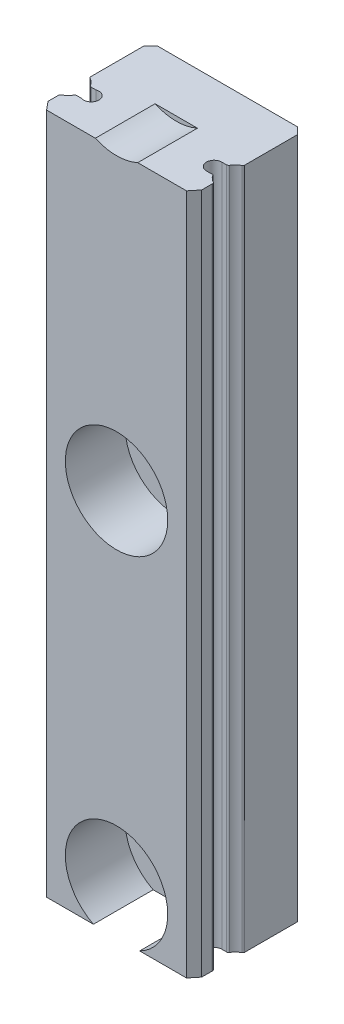
from build123d import *

# Parameters (mm, degrees)
RESSALTO_EXTRUS_O1_DEPTH                             = 1000
CORTE_EXTRUS_O1_START                                = -1000
CORTE_EXTRUS_O1_DEPTH                                = 1000
CORTE_EXTRUS_O2_DEPTH                                = 1001.031261626
CORTE_EXTRUS_O3_DEPTH                                = 1001.031261626
CORTE_EXTRUS_O4_DEPTH                                = 1001.031261626
CORTE_EXTRUS_O5_DEPTH                                = 0.002166667
CORTE_EXTRUS_O6_DEPTH                                = 0.002166667
CORTE_EXTRUS_O7_DEPTH                                = 0.002166667
CORTE_EXTRUS_O8_DEPTH                                = 0.002166667
INCLINA_O1_ANGLE                                     = 45.1469538
ESBO_O10_W                                           = 0.450000001
ESBO_O10_H                                           = 1000
REBAIXO_PARA_PARAFUSO_DE_M_QUINA_DE_CABE_D           = 3.5
REBAIXO_PARA_PARAFUSO_DE_M_QUINA_DE_CABE_CBORE_D     = 6
REBAIXO_PARA_PARAFUSO_DE_M_QUINA_DE_CABE_CBORE_DEPTH = 3.50000002
CHANFRO1_SIZE                                        = 0.062563219
CHANFRO1_SIZE2                                       = 0.062205617
CHANFRO3_START                                       = -3.730761794
CHANFRO3_DEPTH                                       = 0.399013115
CHANFRO4_SIZE                                        = 0.4
FILETE1_R                                            = 0.130000023
SKETCH1_W                                            = 36.072768502
SKETCH1_H                                            = 771.589023544
SKETCH1_W_2                                          = 21.632087489
SKETCH1_H_2                                          = 231.614654652
CUT_EXTRUDE1_DEPTH                                   = 10


with BuildPart() as part:
    # Esboço1 → Ressalto-extrusão1 (new body)
    with BuildSketch(Plane.XZ):
        with BuildLine():
            Line((4.5, 5.4097155), (4.5, 6.01167813))
            Line((4.5, 6.01167813), (4.1, 6.50000002))
            Line((4.1, 6.50000002), (-4.1, 6.50000002))
            Line((-4.1, 6.50000002), (-4.5, 6.01167813))
            Line((-4.5, 6.01167813), (-4.5, 2e-08))
            Line((-4.5, 2e-08), (4.5, 2e-08))
            Line((4.5, 2e-08), (4.5, 3.50196265))
            ThreePointArc((4.5, 3.50196265), (4.477413879, 3.553810372), (4.43494978, 3.59116167))
            ThreePointArc((4.43494978, 3.59116167), (3.930462682, 4.43021964), (4.43494978, 5.26927761))
            ThreePointArc((4.43494978, 5.26927761), (4.490651601, 5.328761203), (4.5, 5.4097155))
        make_face()
    extrude(amount=-RESSALTO_EXTRUS_O1_DEPTH)

    # Esboço2 → Corte-extrusão1 (cut)
    with BuildSketch(Plane(origin=(0, 1000, 0), x_dir=(-1, 0, 0), z_dir=(0, 1, 0)).offset(CORTE_EXTRUS_O1_START)):
        with BuildLine():
            Line((-4.030498711, 4.00588336), (-3.673447948, 4.00588336))
            ThreePointArc((-3.673447948, 4.00588336), (-3.223447946, 4.455883362), (-3.673447948, 4.905883363))
            Line((-3.673447948, 4.905883363), (-3.953580008, 4.905883363))
            ThreePointArc((-3.953580008, 4.905883363), (-4.010719931, 4.899199784), (-4.065149208, 4.917830263))
            ThreePointArc((-4.065149208, 4.917830263), (-3.93114763, 4.466290066), (-4.030498711, 4.00588336))
        make_face()
    extrude(amount=CORTE_EXTRUS_O1_DEPTH, mode=Mode.SUBTRACT)

    # Esboço3 → Corte-extrusão2 (cut, through all)
    with BuildSketch(Plane(origin=(0, 1000, 0), x_dir=(-1, 0, 0), z_dir=(0, 1, 0))):
        with BuildLine():
            Line((4.5, 4.03150278), (4.5, 4.88017535))
            Line((4.5, 4.88017535), (3.66946318, 4.88017535))
            ThreePointArc((3.66946318, 4.88017535), (3.969667593, 4.455839065), (3.66946318, 4.03150278))
            Line((3.66946318, 4.03150278), (4.5, 4.03150278))
        make_face()
    extrude(amount=-CORTE_EXTRUS_O2_DEPTH, mode=Mode.SUBTRACT)

    # Esboço4 → Corte-extrusão3 (cut, through all)
    with BuildSketch(Plane(origin=(0, 1000, 0), x_dir=(-1, 0, 0), z_dir=(0, 1, 0))):
        with BuildLine():
            Line((4.026513974, 4.88017535), (4.5, 4.88017535))
            Line((4.5, 4.88017535), (4.5, 5.328056964))
            ThreePointArc((4.5, 5.328056964), (4.223646078, 5.145991535), (4.026513974, 4.88017535))
        make_face()
    extrude(amount=-CORTE_EXTRUS_O3_DEPTH, mode=Mode.SUBTRACT)

    # Esboço5 → Corte-extrusão4 (cut, through all)
    with BuildSketch(Plane(origin=(0, 1000, 0), x_dir=(-1, 0, 0), z_dir=(0, 1, 0))):
        with BuildLine():
            Line((4.5, 3.583620931), (4.5, 4.03150278))
            Line((4.5, 4.03150278), (4.026513856, 4.03150278))
            ThreePointArc((4.026513856, 4.03150278), (4.223645982, 3.76568645), (4.5, 3.583620931))
        make_face()
    extrude(amount=-CORTE_EXTRUS_O4_DEPTH, mode=Mode.SUBTRACT)

    # Esboço6 → Corte-extrusão5 (cut)
    with BuildSketch(Plane(origin=(0, 1000, 0), x_dir=(-1, 0, 0), z_dir=(0, 1, 0))):
        Polygon((0.891369267, 3.403698133), (0.714701433, 3.168235633), (0.2187042, 2.61105), (1.0945792, 2.61105), (1.0945792, 2.695983333), (0.398689633, 2.695983333), (0.794326433, 3.149466667), (0.9743123, 3.3891), (1.067110588, 3.573407857), (0.95413722, 3.802321701), (0.7876908, 3.88505), (0.54301, 3.88505), (0.375434678, 3.803592619), (0.295011167, 3.6384023), (0.295011167, 3.562), (0.3812718, 3.562), (0.3812718, 3.631766667), (0.437672733, 3.743620833), (0.549645633, 3.800116667), (0.7802262, 3.800116667), (0.893028067, 3.743810633), (0.976240026, 3.576039029), align=None)
    extrude(amount=-CORTE_EXTRUS_O5_DEPTH, mode=Mode.SUBTRACT)

    # Esboço7 → Corte-extrusão6 (cut)
    with BuildSketch(Plane.XZ):
        Polygon((-0.214632167, 3.88505), (-0.953983333, 3.88505), (-0.953983333, 2.61105), (-0.214632167, 2.61105), (-0.214632167, 2.695983333), (-0.86905, 2.695983333), (-0.86905, 3.205583333), (-0.5123963, 3.205583333), (-0.5123963, 3.290516667), (-0.86905, 3.290516667), (-0.86905, 3.800116667), (-0.214632167, 3.800116667), align=None)
    extrude(amount=-CORTE_EXTRUS_O6_DEPTH, mode=Mode.SUBTRACT)

    # Esboço8 → Corte-extrusão7 (cut)
    with BuildSketch(Plane(origin=(0, 1000, 0), x_dir=(-1, 0, 0), z_dir=(0, 1, 0))):
        Polygon((-0.214632167, 3.88505), (-0.953983333, 3.88505), (-0.953983333, 2.61105), (-0.214632167, 2.61105), (-0.214632167, 2.695983333), (-0.86905, 2.695983333), (-0.86905, 3.205583333), (-0.5123963, 3.205583333), (-0.5123963, 3.290516667), (-0.86905, 3.290516667), (-0.86905, 3.800116667), (-0.214632167, 3.800116667), align=None)
    extrude(amount=-CORTE_EXTRUS_O7_DEPTH, mode=Mode.SUBTRACT)

    # Esboço9 → Corte-extrusão8 (cut)
    with BuildSketch(Plane.XZ):
        Polygon((0.510057167, 3.620830633), (0.6071, 3.718655633), (0.6071, 2.609403333), (0.692033333, 2.609403333), (0.692033333, 3.883403333), (0.6741176, 3.883403333), (0.6741176, 3.795069794), (0.3690544, 3.640736667), (0.3690544, 3.551253333), align=None)
    extrude(amount=-CORTE_EXTRUS_O8_DEPTH, mode=Mode.SUBTRACT)

    # Inclinação1
    inclina_o1_faces = [part.faces().sort_by_distance(p)[0] for p in [
        (0.6741176, 0.001083333, 3.839236564),
    ]]
    draft(inclina_o1_faces, Plane(origin=(0.692033333, 0.002166667, 3.883403333), x_dir=(-1, 0, 0), z_dir=(0, 0, -1)), INCLINA_O1_ANGLE)

    # Esboço10 → Corte-Revolução1 (revolve, cut)
    with BuildSketch(Plane.XY.offset(4.455839065)):
        with Locations((-3.294667591, 500)):
            Rectangle(ESBO_O10_W, ESBO_O10_H)
    revolve(axis=Axis((-3.519667591, 1000, 4.455839065), (0, -1, 0)), mode=Mode.SUBTRACT)

    # Rebaixo para parafuso de máquina de cabeça sextavada de M31 (through all)
    with Locations(Plane.XY.offset(6.50000002)):
        with Locations((0, 221.298822188), (0, 201.298822188), (0, 241.298822188), (0, 261.298822188)):
            CounterBoreHole(REBAIXO_PARA_PARAFUSO_DE_M_QUINA_DE_CABE_D / 2, REBAIXO_PARA_PARAFUSO_DE_M_QUINA_DE_CABE_CBORE_D / 2, REBAIXO_PARA_PARAFUSO_DE_M_QUINA_DE_CABE_CBORE_DEPTH)

    # Chanfro1
    chanfro1_edges = [part.edges().sort_by_distance(p)[0] for p in [
        (-0.976240026, 999.998916667, 3.576039029),
    ]]
    chanfro1_side = [part.faces().sort_by_distance(p)[0] for p in [
        (-0.933804646, 999.998916667, 3.489868581),
    ]]
    chamfer(chanfro1_edges, length=CHANFRO1_SIZE, length2=CHANFRO1_SIZE2, reference=chanfro1_side[0])

    # Chanfro3: read off the stored shape, not the designer's step
    # Chanfro3 outline → Chanfro3 (add)
    with BuildSketch(Plane(origin=(0, 0, 0), x_dir=(0.8991051825477068, 0, 0.43773264753254887), z_dir=(0.4377326475325489, 0, -0.8991051825477069)).offset(CHANFRO3_START)):
        Polygon((1.327401403, -999.997833333), (1.31122788, -999.997833333), (1.311999664, -1000), (1.327401403, -1000), align=None)
    extrude(amount=CHANFRO3_DEPTH)

    # Chanfro4
    chanfro4_edges = [part.edges().sort_by_distance(p)[0] for p in [
        (4.5, 500, 2e-08),
        (-4.5, 500, 2e-08),
    ]]
    chamfer(chanfro4_edges, length=CHANFRO4_SIZE)

    # Filete1
    filete1_edges = [part.edges().sort_by_distance(p)[0] for p in [
        (4.030498711, 500, 4.00588336),
        (-4.026513974, 500, 4.88017535),
        (-4.5, 500, 5.328056964),
        (-4.5, 500, 3.583620931),
        (-4.026513856, 500, 4.03150278),
    ]]
    fillet(filete1_edges, radius=FILETE1_R)

    # Sketch1 → Cut-Extrude1 (cut)
    with BuildSketch(Plane(origin=(0, 0, 0), x_dir=(-1, 0, 0), z_dir=(0, 0, -1))):
        with Locations((-9.39117436, 624.361983818)):
            Rectangle(SKETCH1_W, SKETCH1_H)
        with Locations((0.25600221, 82.81425767)):
            Rectangle(SKETCH1_W_2, SKETCH1_H_2)
    extrude(amount=-CUT_EXTRUDE1_DEPTH, mode=Mode.SUBTRACT)


solid = part.part
